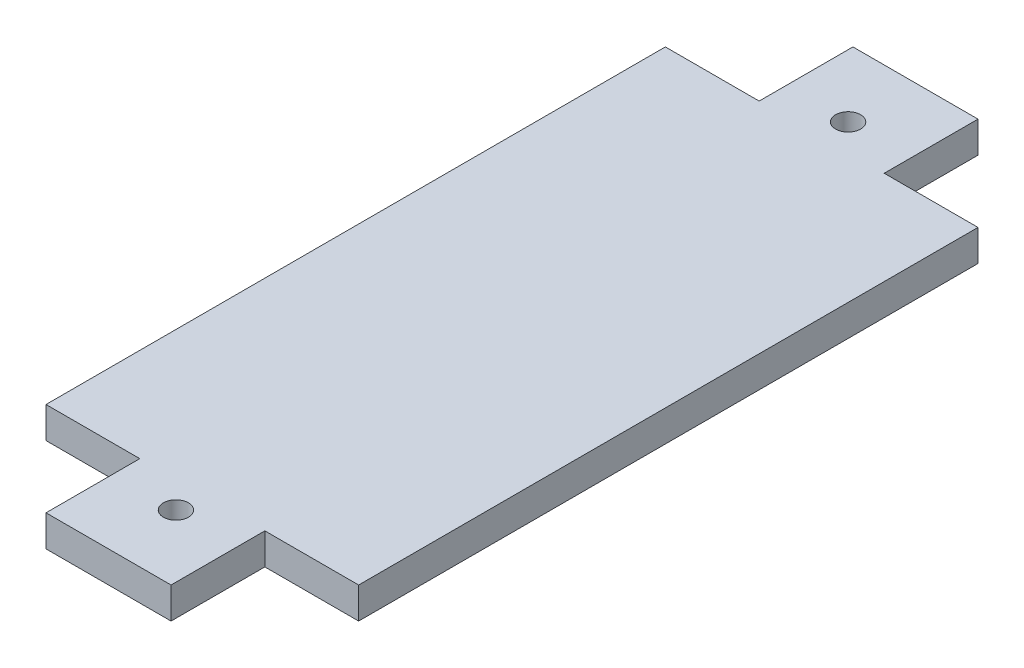
from build123d import *

# Parameters (mm, degrees)
SKETCH_1_R      = 0.4
EXTRUDE_1_DEPTH = 1


with BuildPart() as part:
    # Эскиз1 → Бобышка-Вытянуть1 (new body)
    with BuildSketch(Plane(origin=(0, 0, 0), x_dir=(1, 0, 0), z_dir=(0, 1, 0))):
        Polygon((-2, -12.905), (2, -12.905), (2, -9.905), (5, -9.905), (5, 9.905), (2, 9.905), (2, 12.905), (-2, 12.905), (-2, 9.905), (-5, 9.905), (-5, -9.905), (-2, -9.905), align=None)
        with Locations((0, -10.75)):
            Circle(SKETCH_1_R, mode=Mode.SUBTRACT)
        with Locations((0, 10.75)):
            Circle(SKETCH_1_R, mode=Mode.SUBTRACT)
    extrude(amount=EXTRUDE_1_DEPTH)


solid = part.part
